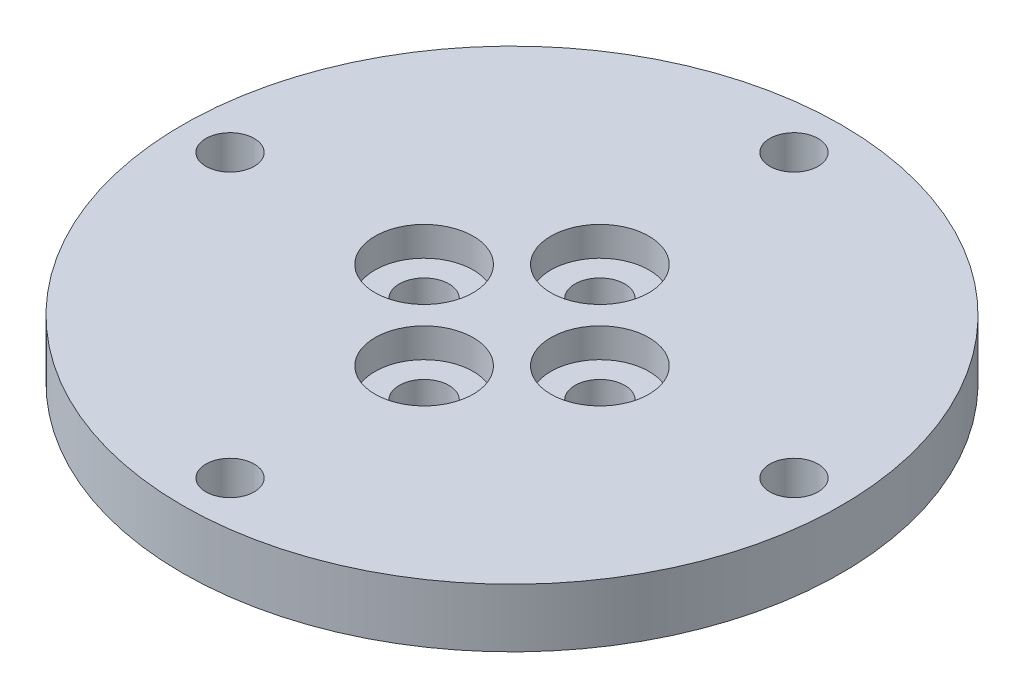
from build123d import *

# Parameters (mm, degrees)
SKETCH_1_R                  = 22.5
EXTRUDE_1_DEPTH             = 4
HOLE_WIZARD_M31_D           = 3.4
HOLE_WIZARD_M31_CBORE_D     = 6.7
HOLE_WIZARD_M31_CBORE_DEPTH = 2
M4X0_71_D                   = 3.3


with BuildPart() as part:
    # Эскиз1 → Бобышка-Вытянуть1 (new body)
    with BuildSketch(Plane(origin=(0, 0, 0), x_dir=(1, 0, 0), z_dir=(0, 1, 0))):
        Circle(SKETCH_1_R)
    extrude(amount=EXTRUDE_1_DEPTH)

    # Цековка для  винта с полукруглой головкой M31 (through all)
    with Locations(Plane(origin=(0, 4, 0), x_dir=(1, 0, 0), z_dir=(0, 1, 0))):
        with Locations((0, 6), (-6, 0), (0, -6), (6, 0)):
            CounterBoreHole(HOLE_WIZARD_M31_D / 2, HOLE_WIZARD_M31_CBORE_D / 2, HOLE_WIZARD_M31_CBORE_DEPTH)

    # Отверстие обработанное метчиком M4x0.71 (through all)
    with Locations(Plane(origin=(0, 4, 0), x_dir=(1, 0, 0), z_dir=(0, 1, 0))):
        with Locations((-19.25, 0), (0, -19.25), (19.25, 0), (0, 19.25)):
            Hole(M4X0_71_D / 2)


solid = part.part
